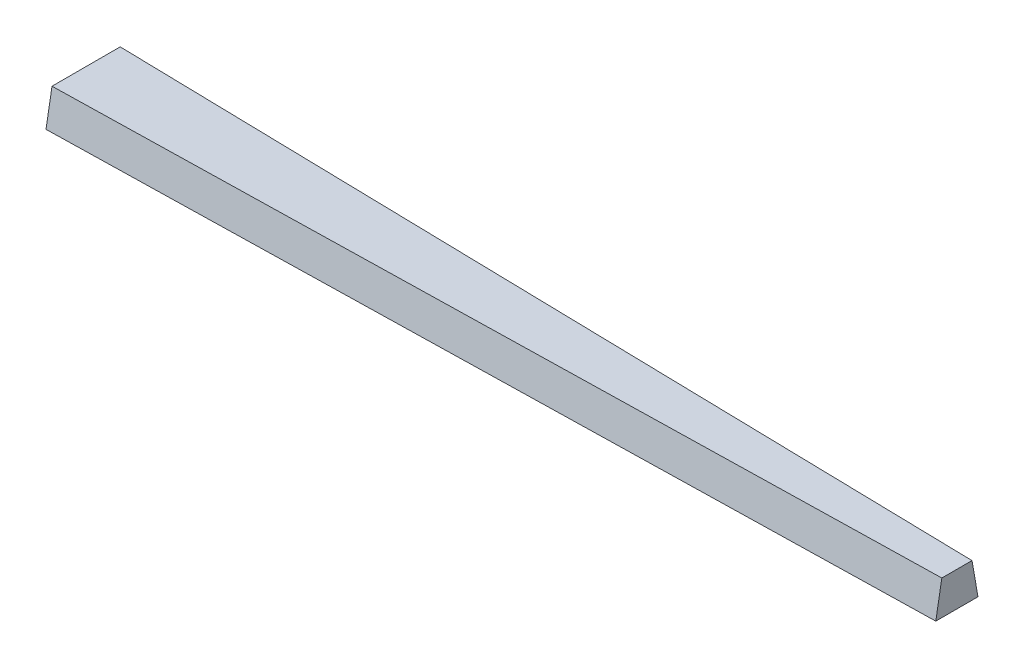
from build123d import *

# Parameters (mm, degrees)
BOSS_EXTRUDE1_DEPTH = 19.05
CHAMFER1_SIZE       = 19.05
CHAMFER1_SIZE_2     = 3.335036558


with BuildPart() as part:
    # Sketch1 → Boss-Extrude1 (new body)
    with BuildSketch(Plane(origin=(0, 0, 0), x_dir=(1, 0, 0), z_dir=(0, 1, 0))):
        Polygon((0, -22.225), (0, 22.225), (482.6, 11.69463054), (482.6, -11.69463054), align=None)
    extrude(amount=BOSS_EXTRUDE1_DEPTH)

    # Chamfer1
    # the kernel refuses this chamfer: 19.05, 3.335036558 mm, written as the material it takes off along each edge
    with BuildSketch(Plane(origin=(532.090771279, 19.05, 10.614738069), x_dir=(0.00014476735017107792, -0.9999779803617965, 0.006634593729589879), z_dir=(-0.9997620270799091, 0, 0.021814885034561207)), Plane(origin=(-49.490771279, 19.05, -23.304892471), x_dir=(0.00014476735017107596, -0.9999779803617965, -0.00663459372958979), z_dir=(0.9997620270799091, 0, 0.021814885034561207))) as chamfer1_piece_1:
        Polygon((CHAMFER1_SIZE * 0.999977980362, -CHAMFER1_SIZE * 0.00663617295905), (-CHAMFER1_SIZE_2 * 0.00663617295888, -CHAMFER1_SIZE_2 * 0.999977980336), (0, 0), align=None)
    extrude(amount=581.719976159, mode=Mode.SUBTRACT)


solid = part.part
